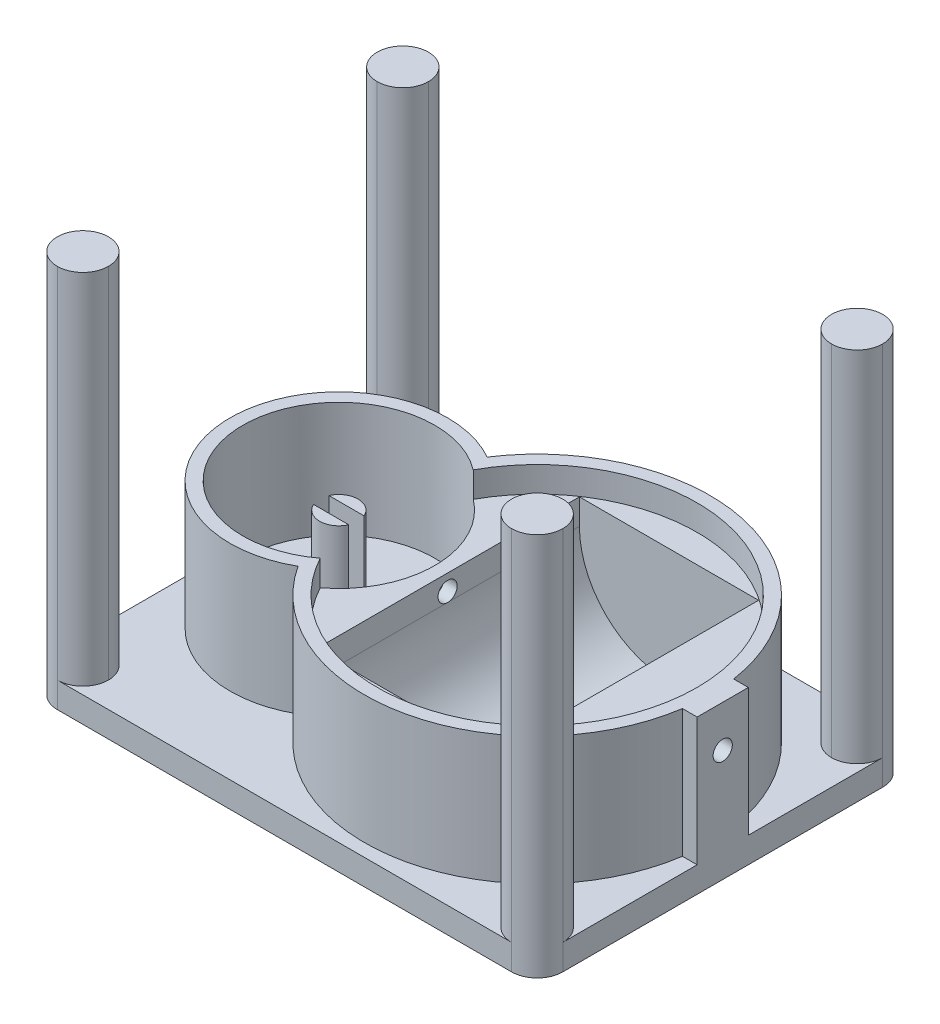
from build123d import *

# Parameters (mm, degrees)
SKETCH1_W            = 39.5
SKETCH1_H            = 29
BOSS_EXTRUDE1_DEPTH  = 2
SKETCH2_R            = 13.5
SKETCH2_R_2          = 8.5
BOSS_EXTRUDE2_DEPTH  = 10
SKETCH3_R            = 12.5
CUT_EXTRUDE1_DEPTH   = 2
SKETCH4_R            = 7.5
CUT_EXTRUDE2_DEPTH   = 9
CUT_EXTRUDE3_START   = -10.3
CUT_EXTRUDE3_DEPTH   = 20.6
BOSS_EXTRUDE3_DEPTH  = 10
CUT_SWEEP1_START     = -214.913833497
CUT_SWEEP1_OUTLINE_R = 0.75
CUT_SWEEP1_DEPTH     = 22.537594322
BOSS_EXTRUDE4_DEPTH  = 7
SKETCH11_W           = 4
SKETCH11_H           = 4
BOSS_EXTRUDE5_DEPTH  = 28
FILLET1_R            = 2


# Read off the part's stored shape, not the designer's step: Cut-Extrude3, Cut-Sweep1
with BuildPart() as part:
    # Sketch1 → Boss-Extrude1 (new body)
    with BuildSketch(Plane(origin=(0, 0, 0), x_dir=(1, 0, 0), z_dir=(0, 1, 0))):
        with Locations((-212.126239175, -24.349172792)):
            Rectangle(SKETCH1_W, SKETCH1_H)
    extrude(amount=BOSS_EXTRUDE1_DEPTH)

    # Sketch2 → Boss-Extrude2 (add)
    with BuildSketch(Plane(origin=(0, 2, 0), x_dir=(1, 0, 0), z_dir=(0, 1, 0))):
        with Locations((-206.876239175, -24.349172792)):
            Circle(SKETCH2_R)
        with Locations((-222.376239175, -24.349172792)):
            Circle(SKETCH2_R_2)
    extrude(amount=BOSS_EXTRUDE2_DEPTH)

    # Sketch3 → Cut-Extrude1 (cut)
    with BuildSketch(Plane(origin=(0, 12, 0), x_dir=(1, 0, 0), z_dir=(0, 1, 0))):
        with Locations(Location((-206.876239175, -24.349172792, 0), (0, 0, 270))):
            Circle(SKETCH3_R)
    extrude(amount=-CUT_EXTRUDE1_DEPTH, mode=Mode.SUBTRACT)

    # Sketch4 → Cut-Extrude2 (cut)
    with BuildSketch(Plane(origin=(0, 12, 0), x_dir=(1, 0, 0), z_dir=(0, 1, 0))):
        with Locations(Location((-222.376239175, -24.349172792, 0), (0, 0, 270))):
            Circle(SKETCH4_R)
    extrude(amount=-CUT_EXTRUDE2_DEPTH, mode=Mode.SUBTRACT)

    # Cut-Extrude3 outline → Cut-Extrude3 (cut)
    with BuildSketch(Plane.XY.offset(24.349172792).offset(CUT_EXTRUDE3_START)):
        with BuildLine():
            ThreePointArc((-213.876239175, 8), (-206.876239175, 1), (-199.876239175, 8))
            Line((-199.876239175, 8), (-199.876239175, 10))
            Line((-199.876239175, 10), (-213.876239175, 10))
            Line((-213.876239175, 10), (-213.876239175, 8))
        make_face()
    extrude(amount=CUT_EXTRUDE3_DEPTH, mode=Mode.SUBTRACT)

    # Sketch7 → Boss-Extrude3 (add)
    with BuildSketch(Plane(origin=(0, 2, 0), x_dir=(1, 0, 0), z_dir=(0, 1, 0))):
        with BuildLine():
            Line((-192.376239175, -26.349172792), (-192.376239175, -24.349172792))
            Line((-192.376239175, -24.349172792), (-192.376239175, -22.349172792))
            Line((-192.376239175, -22.349172792), (-193.525209252, -22.349172792))
            ThreePointArc((-193.525209252, -22.349172792), (-193.413533207, -23.346402619), (-193.376239175, -24.349172792))
            ThreePointArc((-193.376239175, -24.349172792), (-193.413533207, -25.351942966), (-193.525209252, -26.349172792))
            Line((-193.525209252, -26.349172792), (-192.376239175, -26.349172792))
        make_face()
    extrude(amount=BOSS_EXTRUDE3_DEPTH)

    # Cut-Sweep1 outline → Cut-Sweep1 (cut)
    with BuildSketch(Plane.YZ.offset(CUT_SWEEP1_START)):
        with Locations((8.75, 24.349172792)):
            Circle(CUT_SWEEP1_OUTLINE_R)
    extrude(amount=CUT_SWEEP1_DEPTH, mode=Mode.SUBTRACT)

    # Sketch10 → Boss-Extrude4 (add)
    with BuildSketch(Plane(origin=(0, 3, 0), x_dir=(1, 0, 0), z_dir=(0, 1, 0))):
        with BuildLine():
            Line((-223.751011884, -23.749172792), (-222.376239175, -23.749172792))
            Line((-222.376239175, -23.749172792), (-221.001466467, -23.749172792))
            ThreePointArc((-221.001466467, -23.749172792), (-222.376239175, -22.849172792), (-223.751011884, -23.749172792))
        make_face()
        with BuildLine():
            Line((-221.001466467, -24.949172792), (-223.751011884, -24.949172792))
            ThreePointArc((-223.751011884, -24.949172792), (-222.376239175, -25.849172792), (-221.001466467, -24.949172792))
        make_face()
    extrude(amount=BOSS_EXTRUDE4_DEPTH)

    # Sketch11 → Boss-Extrude5 (add)
    with BuildSketch(Plane(origin=(0, 2, 0), x_dir=(1, 0, 0), z_dir=(0, 1, 0))):
        with Locations((-229.876239175, -36.849172792)):
            Rectangle(SKETCH11_W, SKETCH11_H)
        with Locations((-229.876239175, -11.849172792)):
            Rectangle(SKETCH11_W, SKETCH11_H)
        with Locations((-194.376239175, -36.849172792)):
            Rectangle(SKETCH11_W, SKETCH11_H)
        with Locations((-194.376239175, -11.849172792)):
            Rectangle(SKETCH11_W, SKETCH11_H)
    extrude(amount=BOSS_EXTRUDE5_DEPTH)

    # Fillet1
    fillet1_edges = [part.edges().sort_by_distance(p)[0] for p in [
        (-192.376239175, 16, 34.849172792),
        (-192.376239175, 15, 9.849172792),
        (-227.876239175, 16, 9.849172792),
        (-227.876239175, 16, 34.849172792),
        (-192.376239175, 16, 13.849172792),
        (-196.376239175, 16, 13.849172792),
        (-196.376239175, 16, 9.849172792),
        (-192.376239175, 15, 38.849172792),
        (-196.376239175, 16, 38.849172792),
        (-196.376239175, 16, 34.849172792),
        (-227.876239175, 16, 38.849172792),
        (-231.876239175, 15, 38.849172792),
        (-231.876239175, 16, 34.849172792),
        (-227.876239175, 16, 13.849172792),
        (-231.876239175, 16, 13.849172792),
        (-231.876239175, 15, 9.849172792),
    ]]
    fillet(fillet1_edges, radius=FILLET1_R - 0.0001)  # a hair under: the kernel refuses the full size


solid = part.part
